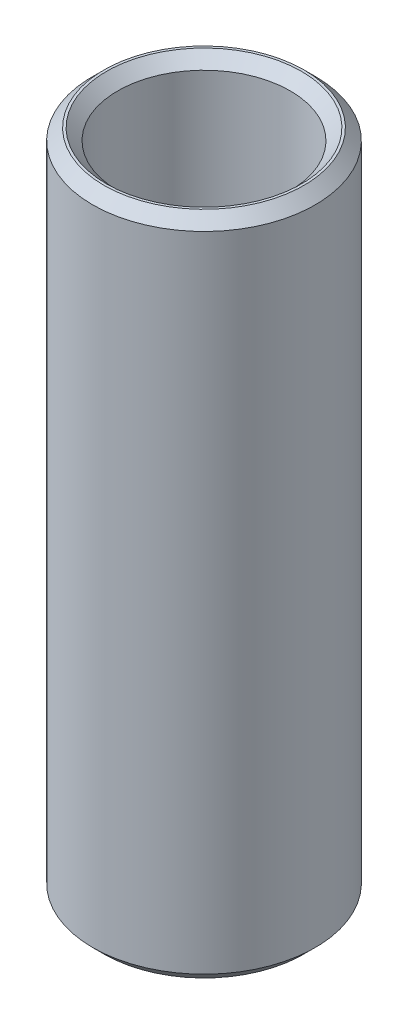
from build123d import *

# Parameters (mm, degrees)
SKETCH1_R           = 12.5
BOSS_EXTRUDE1_DEPTH = 74.782744641
SKETCH2_R           = 9.69226749
CUT_EXTRUDE1_DEPTH  = 77.843730362
CHAMFER1_SIZE       = 1.264209349


with BuildPart() as part:
    # Sketch1 → Boss-Extrude1 (new body)
    with BuildSketch(Plane(origin=(0, 0, 0), x_dir=(1, 0, 0), z_dir=(0, 1, 0))):
        Circle(SKETCH1_R)
    extrude(amount=BOSS_EXTRUDE1_DEPTH)

    # Sketch2 → Cut-Extrude1 (cut, through all)
    with BuildSketch(Plane(origin=(0, 0, 0), x_dir=(1, 0, 0), z_dir=(0, 1, 0))):
        Circle(SKETCH2_R)
    extrude(amount=CUT_EXTRUDE1_DEPTH, mode=Mode.SUBTRACT)

    # Chamfer1
    chamfer1_edges = [part.edges().sort_by_distance(p)[0] for p in [
        (-9.69226749, 74.782744641, 0),
        (-9.69226749, 0, 0),
        (-12.5, 0, 0),
        (-12.5, 74.782744641, 0),
    ]]
    chamfer(chamfer1_edges, length=CHAMFER1_SIZE)


solid = part.part
